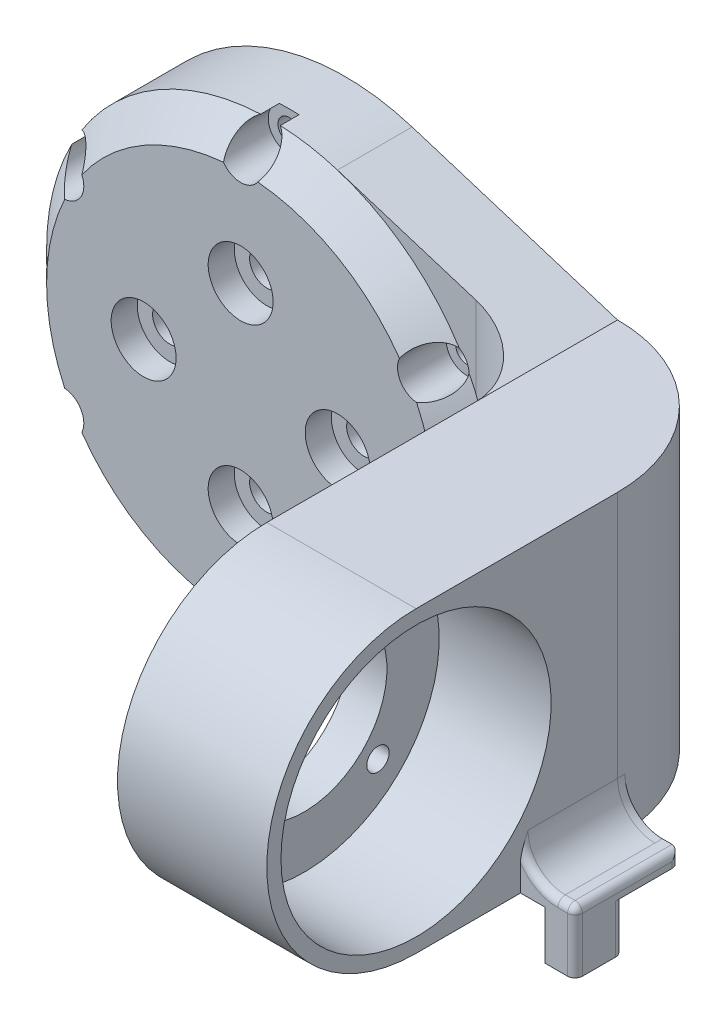
from build123d import *

# Parameters (mm, degrees)
SCHIZZO1_R                         = 30
SCHIZZO1_R_2                       = 21
ESTRUSIONE_ESTRUSIONE1_DEPTH       = 5
SCHIZZO7_R                         = 30
ESTRUSIONE_ESTRUSIONE2_DEPTH       = 5
SCHIZZO3_R                         = 1.5
TAGLIO_ESTRUSIONE3_DEPTH           = 8
SCHIZZO10_R                        = 2.8
TAGLIO_ESTRUSIONE4_DEPTH           = 2.5
RIPETIZIONECIRCOLARE1_COUNT        = 6
ESTRUSIONE_ESTRUSIONE5_DEPTH       = 1
ESTRUSIONE_ESTRUSIONE5_DEPTH_BACK  = 14
ESTRUSIONE_ESTRUSIONE5_START       = -42.5
SCHIZZO12_R                        = 20
SCHIZZO12_R_2                      = 18.1
SCHIZZO13_R                        = 20
SCHIZZO13_R_2                      = 11.1
ESTRUSIONE_ESTRUSIONE6_DEPTH       = 5
SCHIZZO14_R                        = 1.5
TAGLIO_ESTRUSIONE5_DEPTH           = 100.051754149
RIPETIZIONECIRCOLARE2_COUNT        = 4
ESTRUSIONE_ESTRUSIONE9_DEPTH       = 10
SCHIZZO42_R                        = 2.8
TAGLIO_ESTRUSIONE6_DEPTH           = 2.5
ESTRUSIONE_ESTRUSIONE10_REACH      = 87.681
ESTRUSIONE_ESTRUSIONE10_END_RADIUS = 20
SCHIZZO41_W                        = 20
SCHIZZO41_H                        = 40
RACCORDO3_R                        = 9
RACCORDO4_R                        = 20
SCHIZZO43_R                        = 1.2
SCHIZZO43_W                        = 3.2
SCHIZZO43_H                        = 4
SCHIZZO43_R_2                      = 1.25
SCHIZZO43_W_2                      = 4
SCHIZZO43_H_2                      = 6.45
ESTRUSIONE_ESTRUSIONE11_DEPTH      = 6.5
RACCORDO7_R                        = 1
SCHIZZO44_W                        = 27.3
SCHIZZO44_H                        = 14
ESTRUSIONE_ESTRUSIONE12_DEPTH      = 1.8
RACCORDO10_R                       = 5
RACCORDO11_R                       = 1
TAGLIO_ESTRUSIONE8_DEPTH           = 3.5
SCHIZZO47_R                        = 2.3
TAGLIO_ESTRUSIONE9_DEPTH           = 10
SCHIZZO48_R                        = 16.25
TAGLIO_ESTRUSIONE10_DEPTH          = 2
SCHIZZO49_R                        = 20
SCHIZZO49_R_2                      = 2.3
ESTRUSIONE_ESTRUSIONE13_DEPTH      = 4
SMUSSO1_SIZE                       = 10
SCHIZZO50_R                        = 4.35
TAGLIO_ESTRUSIONE11_DEPTH          = 3.5


with BuildPart() as part:
    # Schizzo1 → Estrusione-Estrusione1 (new body)
    with BuildSketch(Plane.XY):
        Circle(SCHIZZO1_R)
        Circle(SCHIZZO1_R_2, mode=Mode.SUBTRACT)
    extrude(amount=ESTRUSIONE_ESTRUSIONE1_DEPTH)

    # Schizzo7 → Estrusione-Estrusione2 (add)
    with BuildSketch(Plane.XY.offset(5)):
        Circle(SCHIZZO7_R)
    extrude(amount=ESTRUSIONE_ESTRUSIONE2_DEPTH)

    # Schizzo3 → Taglio-Estrusione3 (cut)
    with BuildSketch(Plane.XY):
        with Locations((0, 27.5)):
            Circle(SCHIZZO3_R)
    taglio_estrusione3 = extrude(amount=TAGLIO_ESTRUSIONE3_DEPTH, mode=Mode.SUBTRACT)

    # Schizzo10 → Taglio-Estrusione4 (cut)
    with BuildSketch(Plane.XY.offset(10)):
        with Locations((0, 27.5)):
            Circle(SCHIZZO10_R)
    taglio_estrusione4 = extrude(amount=-TAGLIO_ESTRUSIONE4_DEPTH, mode=Mode.SUBTRACT)

    # RipetizioneCircolare1: Taglio-Estrusione3, Taglio-Estrusione4 ×6 about axis
    ripetizionecircolare1_axis = Axis((0, 0, 0), (0, 0, 1))
    add([taglio_estrusione3.rotate(ripetizionecircolare1_axis, i * 360 / RIPETIZIONECIRCOLARE1_COUNT) for i in range(1, RIPETIZIONECIRCOLARE1_COUNT)], mode=Mode.SUBTRACT)
    add([taglio_estrusione4.rotate(ripetizionecircolare1_axis, i * 360 / RIPETIZIONECIRCOLARE1_COUNT) for i in range(1, RIPETIZIONECIRCOLARE1_COUNT)], mode=Mode.SUBTRACT)

    # Schizzo40 → Estrusione-Estrusione9 (add)
    with BuildSketch(Plane.XY):
        with BuildLine():
            Line((56.5, 20), (36.5, 20))
            Line((36.5, 20), (8.971426709, 28.627146257))
            ThreePointArc((8.971426709, 28.627146257), (24.17791142, 17.760309664), (30, 0))
            ThreePointArc((30, 0), (24.17791142, -17.760309664), (8.971426709, -28.627146257))
            Line((8.971426709, -28.627146257), (36.5, -20))
            Line((36.5, -20), (56.5, -20))
            Line((56.5, -20), (56.5, 20))
        make_face()
    extrude(amount=ESTRUSIONE_ESTRUSIONE9_DEPTH)

    # Schizzo42 → Taglio-Estrusione6 (cut)
    with BuildSketch(Plane.XY.offset(10)):
        with Locations((23.815698604, 13.75)):
            Circle(SCHIZZO42_R)
        with Locations((23.815698604, -13.75)):
            Circle(SCHIZZO42_R)
    extrude(amount=-TAGLIO_ESTRUSIONE6_DEPTH, mode=Mode.SUBTRACT)



with BuildPart() as body_2:
    # Schizzo12 → Estrusione-Estrusione5 (new, two sides: drawn at the far end of the back side and taken through both)
    with BuildSketch(Plane.ZY.offset(ESTRUSIONE_ESTRUSIONE5_START - ESTRUSIONE_ESTRUSIONE5_DEPTH_BACK)):
        with Locations((47, 0)):
            Circle(SCHIZZO12_R)
        with Locations((47, 0)):
            Circle(SCHIZZO12_R_2, mode=Mode.SUBTRACT)
    extrude(amount=ESTRUSIONE_ESTRUSIONE5_DEPTH + ESTRUSIONE_ESTRUSIONE5_DEPTH_BACK)


with BuildPart() as body_3:
    # Schizzo13 → Estrusione-Estrusione6 (new body)
    with BuildSketch(Plane.ZY.offset(-41.5)):
        with Locations((47, 0)):
            Circle(SCHIZZO13_R)
        with Locations((47, 0)):
            Circle(SCHIZZO13_R_2, mode=Mode.SUBTRACT)
    extrude(amount=ESTRUSIONE_ESTRUSIONE6_DEPTH)

    # Schizzo14 → Taglio-Estrusione5 (cut, through all)
    with BuildSketch(Plane.ZY.offset(-36.5)):
        with Locations((56.899494937, 9.899494937)):
            Circle(SCHIZZO14_R)
    taglio_estrusione5 = extrude(amount=-TAGLIO_ESTRUSIONE5_DEPTH, mode=Mode.SUBTRACT)

    # RipetizioneCircolare2: Taglio-Estrusione5 ×4 about axis
    ripetizionecircolare2_axis = Axis((0, 0, 47), (1, 0, 0))
    for i in range(1, RIPETIZIONECIRCOLARE2_COUNT):
        add(taglio_estrusione5.rotate(ripetizionecircolare2_axis, i * 360 / RIPETIZIONECIRCOLARE2_COUNT), mode=Mode.SUBTRACT)


with BuildPart() as part_1:
    add(part.part)

    add(body_2.part)  # Estrusione-Estrusione10 merges body 2

    add(body_3.part)  # Estrusione-Estrusione10 merges body 3
    # Estrusione-Estrusione10: up to this cylinder (the profile starts outside it)
    estrusione_estrusione10_end = Plane(origin=(46.5, 0, 47), z_dir=(-1, 0, 0)) * Cylinder(ESTRUSIONE_ESTRUSIONE10_END_RADIUS, 216.362, mode=Mode.PRIVATE)
    # Schizzo41 → Estrusione-Estrusione10 (add, up to the surface)
    with BuildSketch(Plane.XY.offset(10), mode=Mode.PRIVATE) as estrusione_estrusione10_sk1:
        with Locations((46.5, 0)):
            Rectangle(SCHIZZO41_W, SCHIZZO41_H)
    estrusione_estrusione10_tool1 = extrude(estrusione_estrusione10_sk1.sketch, amount=ESTRUSIONE_ESTRUSIONE10_REACH, mode=Mode.PRIVATE) - estrusione_estrusione10_end
    add(estrusione_estrusione10_tool1.solids().sort_by_distance((46.5, 0, 10))[0])

    # Raccordo3
    raccordo3_edges = [part_1.edges().sort_by_distance(p)[0] for p in [
        (36.5, 0, 10),
    ]]
    fillet(raccordo3_edges, radius=RACCORDO3_R)

    # Raccordo4
    raccordo4_edges = [part_1.edges().sort_by_distance(p)[0] for p in [
        (56.5, 0, 0),
    ]]
    fillet(raccordo4_edges, radius=RACCORDO4_R)

    # Schizzo43 → Estrusione-Estrusione11 (add)
    # profile 1 of 5: a face of its own
    with BuildSketch(Plane.XZ.offset(20)):
        with Locations(Location((45.1, 26, 0), (0, 0, 180))):
            Circle(SCHIZZO43_R)
    # profile 2 of 5: a face of its own
    with BuildSketch(Plane.XZ.offset(20)):
        with Locations(Location((54.7, 26, 0), (0, 0, 180))):
            Circle(SCHIZZO43_R)
    # profile 3 of 5: a face of its own
    with BuildSketch(Plane.XZ.offset(20)):
        with Locations((45.1, 21)):
            Rectangle(SCHIZZO43_W, SCHIZZO43_H)
        with Locations(Location((45.1, 21, 0), (0, 0, 180))):
            Circle(SCHIZZO43_R_2, mode=Mode.SUBTRACT)
    # profile 4 of 5: a face of its own
    with BuildSketch(Plane.XZ.offset(20)):
        with Locations((54.7, 21)):
            Rectangle(SCHIZZO43_W, SCHIZZO43_H)
    # profile 5 of 5: a face of its own
    with BuildSketch(Plane.XZ.offset(20)):
        with Locations((61.8, 29.775)):
            Rectangle(SCHIZZO43_W_2, SCHIZZO43_H_2)
        with Locations(Location((61.8, 29.775, 0), (0, 0, 180))):
            Circle(SCHIZZO43_R_2, mode=Mode.SUBTRACT)
    extrude(amount=ESTRUSIONE_ESTRUSIONE11_DEPTH)


with BuildPart() as estrusione_estrusione11_piece_1:
    # of the separate pieces the step leaves, piece 1, a body of its own (estrusione_estrusione11_pieces)
    add(part_1.part.solids().sort_by_distance((56.5, 20, 20))[0])

    # Raccordo7
    raccordo7_edges = [estrusione_estrusione11_piece_1.edges().sort_by_distance(p)[0] for p in [
        (53.1, -23.25, 19),
        (56.3, -23.25, 19),
        (43.5, -23.25, 19),
        (46.7, -23.25, 19),
    ]]
    fillet(raccordo7_edges, radius=RACCORDO7_R)



with BuildPart() as estrusione_estrusione11_piece_2:
    # of the separate pieces the step leaves, piece 2, a body of its own (estrusione_estrusione11_pieces)
    add(part_1.part.solids().sort_by_distance((59.8, -20, 33))[0])


with BuildPart() as estrusione_estrusione11_piece_1_1:
    add(estrusione_estrusione11_piece_1.part)

    add(estrusione_estrusione11_piece_2.part)  # Estrusione-Estrusione12 merges Estrusione-Estrusione11 piece 2
    # Schizzo44 → Estrusione-Estrusione12 (add)
    with BuildSketch(Plane.XZ.offset(20)):
        with Locations((50.15, 26)):
            Rectangle(SCHIZZO44_W, SCHIZZO44_H)
    extrude(amount=-ESTRUSIONE_ESTRUSIONE12_DEPTH)

    # Raccordo10
    raccordo10_edges = [estrusione_estrusione11_piece_1_1.edges().sort_by_distance(p)[0] for p in [
        (56.493745111, -18.2, 19.499843579),
        (56.5, -18.2, 26.5),
    ]]
    fillet(raccordo10_edges, radius=RACCORDO10_R)

    # Raccordo11
    raccordo11_edges = [estrusione_estrusione11_piece_1_1.edges().sort_by_distance(p)[0] for p in [
        (62.65, -18.2, 33),
        (63.8, -18.2, 26),
        (63.8, -22.35, 33),
        (63.8, -19.1, 19),
        (63.8, -23.25, 26.55),
        (57.964466094, -16.735533906, 33),
    ]]
    fillet(raccordo11_edges, radius=RACCORDO11_R)

    # Schizzo46 → Taglio-Estrusione8 (cut)
    with BuildSketch(Plane.ZY.offset(-36.5)):
        with BuildLine():
            ThreePointArc((42.5, -20), (38.714166062, -18.750865472), (35.241683055, -16.792616908))
            Line((35.241683055, -16.792616908), (32.995849236, -20))
            Line((32.995849236, -20), (42.5, -20))
        make_face()
    extrude(amount=-TAGLIO_ESTRUSIONE8_DEPTH, mode=Mode.SUBTRACT)

    # Schizzo47 → Taglio-Estrusione9 (cut)
    with BuildSketch(Plane(origin=(0, 0, 5), x_dir=(-1, 0, 0), z_dir=(0, 0, -1))):
        with Locations((13, 0)):
            Circle(SCHIZZO47_R)
        with Locations((-13, 0)):
            Circle(SCHIZZO47_R)
        with Locations((0, 13)):
            Circle(SCHIZZO47_R)
        with Locations((0, -13)):
            Circle(SCHIZZO47_R)
    extrude(amount=-TAGLIO_ESTRUSIONE9_DEPTH, mode=Mode.SUBTRACT)

    # Schizzo48 → Taglio-Estrusione10 (cut)
    with BuildSketch(Plane(origin=(0, 0, 5), x_dir=(-1, 0, 0), z_dir=(0, 0, -1))):
        Circle(SCHIZZO48_R)
    extrude(amount=-TAGLIO_ESTRUSIONE10_DEPTH, mode=Mode.SUBTRACT)

    # Schizzo49 → Estrusione-Estrusione13 (add)
    with BuildSketch(Plane.XY.offset(10)):
        Circle(SCHIZZO49_R)
        with Locations(Location((0, 13, 0), (0, 0, 180))):
            Circle(SCHIZZO49_R_2, mode=Mode.SUBTRACT)
        with Locations(Location((13, 0, 0), (0, 0, 180))):
            Circle(SCHIZZO49_R_2, mode=Mode.SUBTRACT)
        with Locations(Location((0, -13, 0), (0, 0, 180))):
            Circle(SCHIZZO49_R_2, mode=Mode.SUBTRACT)
        with Locations(Location((-13, 0, 0), (0, 0, 180))):
            Circle(SCHIZZO49_R_2, mode=Mode.SUBTRACT)
    extrude(amount=ESTRUSIONE_ESTRUSIONE13_DEPTH)

    # Smusso1
    # the kernel refuses this chamfer: 10 mm, written as the material it adds along each edge
    with BuildSketch(Plane(origin=(0, 0, 10), x_dir=(1, 0, 0), z_dir=(0, -1, 0))) as smusso1_piece_1_section:
        Polygon((20 + SMUSSO1_SIZE, 0), (20, SMUSSO1_SIZE), (20, 0), align=None)
    smusso1_piece_1 = revolve(axis=Axis((0, 0, 10), (0, 0, 1)), mode=Mode.PRIVATE)
    smusso1_piece_1 = smusso1_piece_1 - Plane(origin=(0, 27.5, 12.142995549), x_dir=(1, 0, 0), z_dir=(0, 0, 1)) * Cylinder(2.8, 120, mode=Mode.PRIVATE)
    smusso1_piece_1 = smusso1_piece_1 - Plane(origin=(0, -27.5, 12.142995549), x_dir=(-1, 0, 0), z_dir=(0, 0, 1)) * Cylinder(2.8, 120, mode=Mode.PRIVATE)
    smusso1_piece_1 = smusso1_piece_1 - Plane(origin=(-23.815698604, 13.75, 12.142995549), x_dir=(0.5000000000000001, 0.8660254037844386, 0), z_dir=(0, 0, 1)) * Cylinder(2.8, 120, mode=Mode.PRIVATE)
    smusso1_piece_1 = smusso1_piece_1 - Plane(origin=(-23.815698604, -13.75, 12.142995549), x_dir=(-0.49999999999999983, 0.8660254037844388, 0), z_dir=(0, 0, 1)) * Cylinder(2.8, 120, mode=Mode.PRIVATE)
    smusso1_piece_1 = smusso1_piece_1 - Plane(origin=(23.815698604, -13.75, 12.142995549), x_dir=(1, 0, 0), z_dir=(0, 0, 1)) * Cylinder(2.8, 120, mode=Mode.PRIVATE)
    smusso1_piece_1 = smusso1_piece_1 - Plane(origin=(23.815698604, 13.75, 12.142995549), x_dir=(1, 0, 0), z_dir=(0, 0, 1)) * Cylinder(2.8, 120, mode=Mode.PRIVATE)
    smusso1_piece_1 = split(smusso1_piece_1, bisect_by=Plane(origin=(24.507712166, -2.6557e-05, 14), z_dir=(0, 0, -1)), keep=Keep.TOP, mode=Mode.PRIVATE)
    add(smusso1_piece_1)

    # Schizzo50 → Taglio-Estrusione11 (cut)
    with BuildSketch(Plane.XY.offset(14)):
        with Locations((0, 13)):
            Circle(SCHIZZO50_R)
        with Locations((-13, 0)):
            Circle(SCHIZZO50_R)
        with Locations((13, 0)):
            Circle(SCHIZZO50_R)
        with Locations((0, -13)):
            Circle(SCHIZZO50_R)
    extrude(amount=-TAGLIO_ESTRUSIONE11_DEPTH, mode=Mode.SUBTRACT)


solid = estrusione_estrusione11_piece_1_1.part
